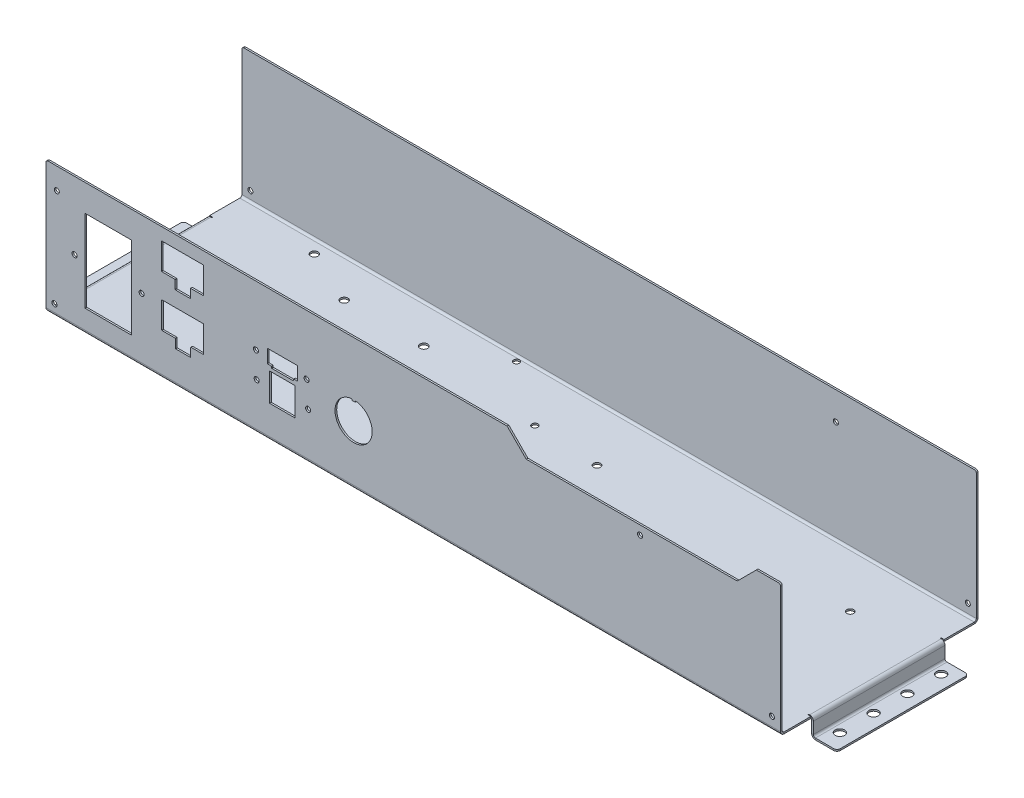
from build123d import *

# Parameters (mm, degrees)
SKETCH1_W                     = 435
SKETCH1_H                     = 115
BASE_FLANGE1_DEPTH            = 1
EDGE_FLANGE1_STRIP_W          = 6.428
EDGE_FLANGE1_STRIP_H          = 1
EDGE_FLANGE1_STRIP_CUT_DEPTH  = 435
EDGE_FLANGE1_DEPTH            = 435
EDGE_FLANGE2_STRIP_W          = 6.428
EDGE_FLANGE2_STRIP_H          = 1
EDGE_FLANGE2_STRIP_CUT_DEPTH  = 435
EDGE_FLANGE2_DEPTH            = 435
EDGE_FLANGE3_STRIP_W          = 6.428
EDGE_FLANGE3_STRIP_H          = 1
EDGE_FLANGE3_STRIP_CUT_DEPTH  = 77.939438076
EDGE_FLANGE3_RELIEF_W         = 6.928
EDGE_FLANGE3_RELIEF_H         = 0.5
EDGE_FLANGE3_RELIEF_CUT_DEPTH = 1
EDGE_FLANGE3_DEPTH            = 77.939438076
EDGE_FLANGE4_STRIP_W          = 6.428
EDGE_FLANGE4_STRIP_H          = 1
EDGE_FLANGE4_STRIP_CUT_DEPTH  = 77.939438076
EDGE_FLANGE4_DEPTH            = 77.939438076
FILLET1_R                     = 2
FILLET2_R                     = 1.21
CUT_EXTRUDE1_DEPTH            = 10
SKETCH23_R                    = 1.5
SKETCH23_W                    = 15.1
SKETCH23_H                    = 16.6
CUT_EXTRUDE3_DEPTH            = 10
CUT_EXTRUDE4_DEPTH            = 10
SKETCH25_R                    = 1.5
CUT_EXTRUDE5_DEPTH            = 10
SKETCH26_R                    = 1.5
CUT_EXTRUDE6_DEPTH            = 10
SKETCH29_R                    = 2.2
SKETCH29_R_2                  = 2.273141147
SKETCH29_R_3                  = 1.848067984
SKETCH29_R_4                  = 1.85
SKETCH29_R_5                  = 1.75
SKETCH29_R_6                  = 1.785982671
SKETCH29_R_7                  = 2.047418075
SKETCH29_R_8                  = 2
CUT_EXTRUDE8_DEPTH            = 10
SKETCH30_R                    = 1.5
CUT_EXTRUDE9_DEPTH            = 10
SKETCH31_R                    = 2.8
CUT_EXTRUDE10_DEPTH           = 10
MIRROR4_COPY_1_SKETCH_R       = 2.8
MIRROR4_COPY_1_DEPTH          = 10
SKETCH37_R                    = 1.5
CUT_EXTRUDE12_DEPTH           = 10


# Sheet-metal steps are written as plain solids
with BuildPart() as part:
    # Sketch1 → Base-Flange1 (new body)
    with BuildSketch(Plane(origin=(0, 0, 0), x_dir=(1, 0, 0), z_dir=(0, 1, 0))):
        Rectangle(SKETCH1_W, SKETCH1_H)
    extrude(amount=-BASE_FLANGE1_DEPTH)

    # Edge-Flange1 strip (across the edge) → Edge-Flange1 strip cut (cut)
    with BuildSketch(Plane(origin=(-217.5, 0, 57.5), x_dir=(0, 0, -1), z_dir=(1, 0, 0))):
        with Locations((-2, -0.5)):
            Rectangle(EDGE_FLANGE1_STRIP_W, EDGE_FLANGE1_STRIP_H)
    extrude(amount=EDGE_FLANGE1_STRIP_CUT_DEPTH, mode=Mode.SUBTRACT)

    # Edge-Flange1 section (across the edge) → Edge-Flange1 (add)
    with BuildSketch(Plane(origin=(-217.5, 0, 57.5), x_dir=(0, 0, -1), z_dir=(1, 0, 0))):
        with BuildLine():
            Line((-1, 1.214), (-1, 77))
            Line((-1, 77), (0, 77))
            Line((0, 77), (0, 1.214))
            ThreePointArc((0, 1.214), (0.355572368, 0.355572368), (1.214, 0))
            Line((1.214, 0), (1.214, -1))
            ThreePointArc((1.214, -1), (-0.351534414, -0.351534414), (-1, 1.214))
        make_face()
    extrude(amount=EDGE_FLANGE1_DEPTH)

    # Edge-Flange2 strip (across the edge) → Edge-Flange2 strip cut (cut)
    with BuildSketch(Plane(origin=(217.5, 0, -57.5), x_dir=(0, 0, 1), z_dir=(-1, 0, 0))):
        with Locations((-2, -0.5)):
            Rectangle(EDGE_FLANGE2_STRIP_W, EDGE_FLANGE2_STRIP_H)
    extrude(amount=EDGE_FLANGE2_STRIP_CUT_DEPTH, mode=Mode.SUBTRACT)

    # Edge-Flange2 section (across the edge) → Edge-Flange2 (add)
    with BuildSketch(Plane(origin=(217.5, 0, -57.5), x_dir=(0, 0, 1), z_dir=(-1, 0, 0))):
        with BuildLine():
            Line((-1, 1.214), (-1, 77))
            Line((-1, 77), (0, 77))
            Line((0, 77), (0, 1.214))
            ThreePointArc((0, 1.214), (0.355572368, 0.355572368), (1.214, 0))
            Line((1.214, 0), (1.214, -1))
            ThreePointArc((1.214, -1), (-0.351534414, -0.351534414), (-1, 1.214))
        make_face()
    extrude(amount=EDGE_FLANGE2_DEPTH)

    # Edge-Flange3 strip (across the edge) → Edge-Flange3 strip cut (cut)
    with BuildSketch(Plane(origin=(217.5, -1, -37.939924044), x_dir=(-1, 0, 0), z_dir=(0, 0, 1))):
        with Locations((-2, -0.5)):
            Rectangle(EDGE_FLANGE3_STRIP_W, EDGE_FLANGE3_STRIP_H)
    edge_flange3_strip_cut = extrude(amount=EDGE_FLANGE3_STRIP_CUT_DEPTH, mode=Mode.SUBTRACT)

    # Edge-Flange3 relief (on the sheet) → Edge-Flange3 relief cut (cut)
    with BuildSketch(Plane(origin=(216.286, -1, -37.939924044), x_dir=(-1, 0, 0), z_dir=(0, -1, 0))):
        with Locations((-2.964, 0.25)):
            Rectangle(EDGE_FLANGE3_RELIEF_W, EDGE_FLANGE3_RELIEF_H)
        with Locations((-2.964, -78.189438076)):
            Rectangle(EDGE_FLANGE3_RELIEF_W, EDGE_FLANGE3_RELIEF_H)
    edge_flange3_relief_cut = extrude(amount=-EDGE_FLANGE3_RELIEF_CUT_DEPTH, mode=Mode.SUBTRACT)

    # Edge-Flange3 section (across the edge) → Edge-Flange3 (add)
    with BuildSketch(Plane(origin=(217.5, -1, -37.939924044), x_dir=(-1, 0, 0), z_dir=(0, 0, 1))):
        with BuildLine():
            Line((-1, 1.214), (-1, 9.214))
            Line((-1, 9.214), (0, 9.214))
            Line((0, 9.214), (0, 1.214))
            ThreePointArc((0, 1.214), (0.355572368, 0.355572368), (1.214, 0))
            Line((1.214, 0), (1.214, -1))
            ThreePointArc((1.214, -1), (-0.351534414, -0.351534414), (-1, 1.214))
        make_face()
    edge_flange3 = extrude(amount=EDGE_FLANGE3_DEPTH)

    # Edge-Flange4 strip (across the edge) → Edge-Flange4 strip cut (cut)
    with BuildSketch(Plane(origin=(218.5, -10.214, 39.999514032), x_dir=(0, 1, 0), z_dir=(0, 0, -1))):
        with Locations((-2, -0.5)):
            Rectangle(EDGE_FLANGE4_STRIP_W, EDGE_FLANGE4_STRIP_H)
    edge_flange4_strip_cut = extrude(amount=EDGE_FLANGE4_STRIP_CUT_DEPTH, mode=Mode.SUBTRACT)

    # Edge-Flange4 section (across the edge) → Edge-Flange4 (add)
    with BuildSketch(Plane(origin=(218.5, -10.214, 39.999514032), x_dir=(0, 1, 0), z_dir=(0, 0, -1))):
        with BuildLine():
            Line((-1, 1.214), (-1, 14))
            Line((-1, 14), (0, 14))
            Line((0, 14), (0, 1.214))
            ThreePointArc((0, 1.214), (0.355572368, 0.355572368), (1.214, 0))
            Line((1.214, 0), (1.214, -1))
            ThreePointArc((1.214, -1), (-0.351534414, -0.351534414), (-1, 1.214))
        make_face()
    edge_flange4 = extrude(amount=EDGE_FLANGE4_DEPTH)

    # Mirror1: Edge-Flange3 strip cut, Edge-Flange3 relief cut, Edge-Flange3, Edge-Flange4 strip cut, Edge-Flange4 across plane
    add(edge_flange3_strip_cut.mirror(Plane(origin=(0, 0, 0), x_dir=(0, 0, 1), z_dir=(1, 0, 0))), mode=Mode.SUBTRACT)
    add(edge_flange3_relief_cut.mirror(Plane(origin=(0, 0, 0), x_dir=(0, 0, 1), z_dir=(1, 0, 0))), mode=Mode.SUBTRACT)
    add(edge_flange3.mirror(Plane(origin=(0, 0, 0), x_dir=(0, 0, 1), z_dir=(1, 0, 0))))
    add(edge_flange4_strip_cut.mirror(Plane(origin=(0, 0, 0), x_dir=(0, 0, 1), z_dir=(1, 0, 0))), mode=Mode.SUBTRACT)
    add(edge_flange4.mirror(Plane(origin=(0, 0, 0), x_dir=(0, 0, 1), z_dir=(1, 0, 0))))

    # Fillet1
    fillet1_edges = [part.edges().sort_by_distance(p)[0] for p in [
        (232.5, -10.714, 39.999514032),
        (232.5, -10.714, -37.939924044),
        (-232.5, -10.714, -37.939924044),
        (-232.5, -10.714, 39.999514032),
    ]]
    fillet(fillet1_edges, radius=FILLET1_R)

    # Fillet2
    fillet2_edges = [part.edges().sort_by_distance(p)[0] for p in [
        (-217.5, 77, 58),
        (217.5, 77, 58),
        (217.5, 77, -58),
        (-217.5, 77, -58),
    ]]
    fillet(fillet2_edges, radius=FILLET2_R)

    # Sketch18 → Cut-Extrude1 (cut)
    with BuildSketch(Plane.XY.offset(58.5)):
        Polygon((191.915120407, 65.686291501), (203.228828906, 77), (55.601411908, 77), (66.915120407, 65.686291501), align=None)
    extrude(amount=-CUT_EXTRUDE1_DEPTH, mode=Mode.SUBTRACT)

    # Sketch23 → Cut-Extrude3 (cut)
    with BuildSketch(Plane.XY.offset(58.5)):
        with Locations((-92.747170909, 26.65345646)):
            Circle(SKETCH23_R)
        with Locations((-62.247170909, 26.65345646)):
            Circle(SKETCH23_R)
        with Locations((-77.497170909, 26.65345646)):
            Rectangle(SKETCH23_W, SKETCH23_H)
    extrude(amount=-CUT_EXTRUDE3_DEPTH, mode=Mode.SUBTRACT)

    # Sketch24 → Cut-Extrude4 (cut)
    with BuildSketch(Plane.XY.offset(58.5)):
        with BuildLine():
            Line((-36.12115463, 44.212330216), (-34.52115463, 44.212330216))
            ThreePointArc((-34.52115463, 44.212330216), (-34.379733273, 44.27090886), (-34.32115463, 44.412330216))
            Line((-34.32115463, 44.412330216), (-34.32115463, 44.827126292))
            ThreePointArc((-34.32115463, 44.827126292), (-34.254487963, 44.97619749), (-34.098932407, 45.02588789))
            ThreePointArc((-34.098932407, 45.02588789), (-35.32115463, 23.094), (-36.543376852, 45.02588789))
            ThreePointArc((-36.543376852, 45.02588789), (-36.387821296, 44.97619749), (-36.32115463, 44.827126292))
            Line((-36.32115463, 44.827126292), (-36.32115463, 44.412330216))
            ThreePointArc((-36.32115463, 44.412330216), (-36.262575986, 44.27090886), (-36.12115463, 44.212330216))
        make_face()
    extrude(amount=-CUT_EXTRUDE4_DEPTH, mode=Mode.SUBTRACT)

    # Sketch25 → Cut-Extrude5 (cut)
    with BuildSketch(Plane.XY.offset(58.5)):
        with Locations((-93.160858285, 41.648976573)):
            Circle(SKETCH25_R)
        with Locations((-63.160858285, 41.648976573)):
            Circle(SKETCH25_R)
        with BuildLine():
            Line((-86.243945536, 45.931723492), (-68.743945536, 45.931723492))
            ThreePointArc((-68.743945536, 45.931723492), (-68.602524179, 45.873144848), (-68.543945536, 45.731723492))
            Line((-68.543945536, 45.731723492), (-68.543945536, 38.131723492))
            ThreePointArc((-68.543945536, 38.131723492), (-68.602524179, 37.990302136), (-68.743945536, 37.931723492))
            Line((-68.743945536, 37.931723492), (-70.771469749, 37.931723492))
            ThreePointArc((-70.771469749, 37.931723492), (-70.912891105, 37.873144848), (-70.971469749, 37.731723492))
            Line((-70.971469749, 37.731723492), (-70.971469749, 37.102540901))
            ThreePointArc((-70.971469749, 37.102540901), (-71.030048393, 36.961119545), (-71.171469749, 36.902540901))
            Line((-71.171469749, 36.902540901), (-83.727466401, 36.902540901))
            ThreePointArc((-83.727466401, 36.902540901), (-83.868887757, 36.961119545), (-83.927466401, 37.102540901))
            Line((-83.927466401, 37.102540901), (-83.927466401, 37.731723492))
            ThreePointArc((-83.927466401, 37.731723492), (-83.986045044, 37.873144848), (-84.127466401, 37.931723492))
            Line((-84.127466401, 37.931723492), (-86.243945536, 37.931723492))
            ThreePointArc((-86.243945536, 37.931723492), (-86.385366892, 37.990302136), (-86.443945536, 38.131723492))
            Line((-86.443945536, 38.131723492), (-86.443945536, 45.731723492))
            ThreePointArc((-86.443945536, 45.731723492), (-86.385366892, 45.873144848), (-86.243945536, 45.931723492))
        make_face()
    extrude(amount=-CUT_EXTRUDE5_DEPTH, mode=Mode.SUBTRACT)

    # Sketch26 → Cut-Extrude6 (cut)
    with BuildSketch(Plane.XY.offset(58.5)):
        with Locations((-200.578308116, 36.802921414)):
            Circle(SKETCH26_R)
        with Locations((-160.878308116, 36.777854193)):
            Circle(SKETCH26_R)
        with BuildLine():
            Line((-166.978308116, 12.60321914), (-166.978308116, 60.952854193))
            ThreePointArc((-166.978308116, 60.952854193), (-167.03688676, 61.094275549), (-167.178308116, 61.152854193))
            Line((-167.178308116, 61.152854193), (-194.278308116, 61.152854193))
            ThreePointArc((-194.278308116, 61.152854193), (-194.419729472, 61.094275549), (-194.478308116, 60.952854193))
            Line((-194.478308116, 60.952854193), (-194.478308116, 12.652624354))
            ThreePointArc((-194.478308116, 12.652624354), (-194.419858324, 12.511331967), (-194.27867273, 12.452624686))
            Line((-194.27867273, 12.452624686), (-167.17867273, 12.403219472))
            ThreePointArc((-167.17867273, 12.403219472), (-167.037015729, 12.461668932), (-166.978308116, 12.60321914))
        make_face()
        with BuildLine():
            Line((-148.751054534, 39.547958162), (-124.351054534, 39.547958162))
            ThreePointArc((-124.351054534, 39.547958162), (-124.209633178, 39.489379519), (-124.151054534, 39.347958162))
            Line((-124.151054534, 39.347958162), (-124.151054534, 23.997958162))
            ThreePointArc((-124.151054534, 23.997958162), (-124.209633178, 23.856536806), (-124.351054534, 23.797958162))
            Line((-124.351054534, 23.797958162), (-131.601054534, 23.797958162))
            ThreePointArc((-131.601054534, 23.797958162), (-131.74247589, 23.739379519), (-131.801054534, 23.597958162))
            Line((-131.801054534, 23.597958162), (-131.801054534, 18.647958162))
            ThreePointArc((-131.801054534, 18.647958162), (-131.859633178, 18.506536806), (-132.001054534, 18.447958162))
            Line((-132.001054534, 18.447958162), (-140.601054534, 18.447958162))
            ThreePointArc((-140.601054534, 18.447958162), (-140.74247589, 18.506536806), (-140.801054534, 18.647958162))
            Line((-140.801054534, 18.647958162), (-140.801054534, 23.597958162))
            ThreePointArc((-140.801054534, 23.597958162), (-140.859633178, 23.739379519), (-141.001054534, 23.797958162))
            Line((-141.001054534, 23.797958162), (-148.751054534, 23.797958162))
            ThreePointArc((-148.751054534, 23.797958162), (-148.89247589, 23.856536806), (-148.951054534, 23.997958162))
            Line((-148.951054534, 23.997958162), (-148.951054534, 39.347958162))
            ThreePointArc((-148.951054534, 39.347958162), (-148.89247589, 39.489379519), (-148.751054534, 39.547958162))
        make_face()
        with BuildLine():
            Line((-148.951054534, 69.682108128), (-124.551054534, 69.682108128))
            ThreePointArc((-124.551054534, 69.682108128), (-124.409633178, 69.623529485), (-124.351054534, 69.482108128))
            Line((-124.351054534, 69.482108128), (-124.351054534, 54.132108128))
            ThreePointArc((-124.351054534, 54.132108128), (-124.409633178, 53.990686772), (-124.551054534, 53.932108128))
            Line((-124.551054534, 53.932108128), (-131.801054534, 53.932108128))
            ThreePointArc((-131.801054534, 53.932108128), (-131.94247589, 53.873529485), (-132.001054534, 53.732108128))
            Line((-132.001054534, 53.732108128), (-132.001054534, 48.782108128))
            ThreePointArc((-132.001054534, 48.782108128), (-132.059633178, 48.640686772), (-132.201054534, 48.582108128))
            Line((-132.201054534, 48.582108128), (-140.801054534, 48.582108128))
            ThreePointArc((-140.801054534, 48.582108128), (-140.94247589, 48.640686772), (-141.001054534, 48.782108128))
            Line((-141.001054534, 48.782108128), (-141.001054534, 53.732108128))
            ThreePointArc((-141.001054534, 53.732108128), (-141.059633178, 53.873529485), (-141.201054534, 53.932108128))
            Line((-141.201054534, 53.932108128), (-148.951054534, 53.932108128))
            ThreePointArc((-148.951054534, 53.932108128), (-149.09247589, 53.990686772), (-149.151054534, 54.132108128))
            Line((-149.151054534, 54.132108128), (-149.151054534, 69.482108128))
            ThreePointArc((-149.151054534, 69.482108128), (-149.09247589, 69.623529485), (-148.951054534, 69.682108128))
        make_face()
    extrude(amount=-CUT_EXTRUDE6_DEPTH, mode=Mode.SUBTRACT)

    # Sketch29 → Cut-Extrude8 (cut)
    with BuildSketch(Plane.XZ.offset(1)):
        with Locations(Location((-166.731681202, -2.49, 0), (0, 0, 270))):
            Circle(SKETCH29_R)
        with Locations(Location((-166.731681202, -49.66, 0), (0, 0, 270))):
            Circle(SKETCH29_R)
        with Locations(Location((-134.211681202, -34.82, 0), (0, 0, 270))):
            Circle(SKETCH29_R)
        with Locations(Location((-87.041681202, -34.82, 0), (0, 0, 270))):
            Circle(SKETCH29_R_2)
        with Locations(Location((-95.904575685, 5, 0), (0, 0, 270))):
            Circle(SKETCH29_R_3)
        with Locations(Location((-37.904575685, 5, 0), (0, 0, 270))):
            Circle(SKETCH29_R_4)
        with Locations(Location((-37.904575685, 54, 0), (0, 0, 270))):
            Circle(SKETCH29_R_4)
        with Locations(Location((-51.698034446, -54.38, 0), (0, 0, 270))):
            Circle(SKETCH29_R_5)
        with Locations(Location((-13.438034446, -27.02, 0), (0, 0, 270))):
            Circle(SKETCH29_R_6)
        with Locations(Location((25.36, -25, 0), (0, 0, 270))):
            Circle(SKETCH29_R_7)
        with Locations(Location((25.36, 25, 0), (0, 0, 270))):
            Circle(SKETCH29_R_8)
        with Locations(Location((175.36, 25, 0), (0, 0, 270))):
            Circle(SKETCH29_R_8)
        with Locations(Location((175.36, -25, 0), (0, 0, 270))):
            Circle(SKETCH29_R_8)
    extrude(amount=-CUT_EXTRUDE8_DEPTH, mode=Mode.SUBTRACT)

    # Sketch30 → Cut-Extrude9 (cut)
    with BuildSketch(Plane.XY.offset(58.5)):
        with Locations((212.474203235, 6.561824627)):
            Circle(SKETCH30_R)
        with Locations((134.335101832, 60.450528514)):
            Circle(SKETCH30_R)
        with Locations((-212.474827346, 5.681824627)):
            Circle(SKETCH30_R)
    cut_extrude9 = extrude(amount=-CUT_EXTRUDE9_DEPTH, mode=Mode.SUBTRACT)

    # Mirror2: Cut-Extrude9 across plane
    add(cut_extrude9.mirror(Plane.XY), mode=Mode.SUBTRACT)

    # Sketch31 → Cut-Extrude10 (cut)
    with BuildSketch(Plane(origin=(0, -10.214, 0), x_dir=(1, 0, 0), z_dir=(0, 1, 0))):
        with Locations(Location((-224.18, 10, 0), (0, 0, 180))):
            Circle(SKETCH31_R)
        with Locations(Location((-224.18, 30, 0), (0, 0, 180))):
            Circle(SKETCH31_R)
    cut_extrude10 = extrude(amount=-CUT_EXTRUDE10_DEPTH, mode=Mode.SUBTRACT)

    # Mirror3: Cut-Extrude10 across plane
    add(cut_extrude10.mirror(Plane.XY), mode=Mode.SUBTRACT)

    # Mirror4: Cut-Extrude10 across plane
    add(cut_extrude10.mirror(Plane(origin=(0, 0, 0), x_dir=(0, 0, 1), z_dir=(1, 0, 0))), mode=Mode.SUBTRACT)

    # Mirror4 copy 1 sketch → Mirror4 copy 1 (cut)
    with BuildSketch(Plane(origin=(0, -10.214, 0), x_dir=(-1, 0, 0), z_dir=(0, 1, 0))):
        with Locations(Location((-224.18, 10, 0), (0, 0, 180))):
            Circle(MIRROR4_COPY_1_SKETCH_R)
        with Locations(Location((-224.18, 30, 0), (0, 0, 180))):
            Circle(MIRROR4_COPY_1_SKETCH_R)
    extrude(amount=-MIRROR4_COPY_1_DEPTH, mode=Mode.SUBTRACT)

    # Sketch37 → Cut-Extrude12 (cut)
    with BuildSketch(Plane.XY.offset(58.5)):
        with Locations((-211.115599205, 64.325599205)):
            Circle(SKETCH37_R)
    extrude(amount=-CUT_EXTRUDE12_DEPTH, mode=Mode.SUBTRACT)


solid = part.part
